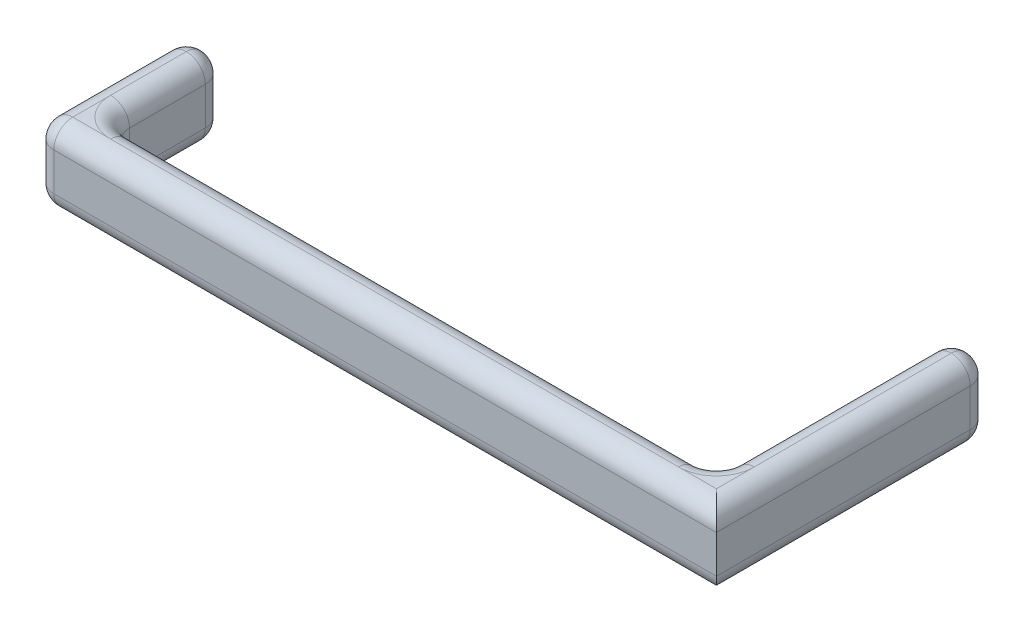
from build123d import *

# Parameters (mm, degrees)
SKETCH1_W           = 812.8
SKETCH1_H           = 101.6
BOSS_EXTRUDE1_DEPTH = 50.8
SKETCH2_W           = 50.8
SKETCH2_H           = 101.6
BOSS_EXTRUDE2_DEPTH = 203.2
SKETCH6_W           = 365.887
SKETCH6_H           = 101.6
BOSS_EXTRUDE4_DEPTH = 50.8
FILLET2_R           = 25.4


with BuildPart() as part:
    # Sketch1 → Boss-Extrude1 (new body)
    with BuildSketch(Plane.XY):
        with Locations((-406.4, 50.8)):
            Rectangle(SKETCH1_W, SKETCH1_H)
    extrude(amount=BOSS_EXTRUDE1_DEPTH)

    # Sketch2 → Boss-Extrude2 (add)
    with BuildSketch(Plane.XY.offset(50.8)):
        with Locations((-838.2, 50.8)):
            Rectangle(SKETCH2_W, SKETCH2_H)
        with Locations((25.4, 50.8)):
            Rectangle(SKETCH2_W, SKETCH2_H)
    extrude(amount=-BOSS_EXTRUDE2_DEPTH)

    # Sketch6 → Boss-Extrude4 (add)
    with BuildSketch(Plane(origin=(50.8, 0, 0), x_dir=(0, 0, -1), z_dir=(1, 0, 0))):
        with Locations((132.1435, 50.8)):
            Rectangle(SKETCH6_W, SKETCH6_H)
    extrude(amount=-BOSS_EXTRUDE4_DEPTH)

    # Fillet2
    fillet2_edges = [part.edges().sort_by_distance(p)[0] for p in [
        (-406.4, 0, 50.8),
        (-812.8, 101.6, -76.2),
        (-812.8, 50.8, -152.4),
        (-838.2, 0, -152.4),
        (-812.8, 0, -76.2),
        (-863.6, 50.8, -152.4),
        (-863.6, 0, -50.8),
        (-838.2, 101.6, -152.4),
        (-863.6, 101.6, -50.8),
        (-863.6, 50.8, 50.8),
        (0, 0, -157.5435),
        (0, 101.6, -157.5435),
        (50.8, 101.6, -132.1435),
        (50.8, 0, -132.1435),
        (50.8, 50.8, -315.087),
        (25.4, 0, -315.087),
        (0, 50.8, -315.087),
        (25.4, 101.6, -315.087),
        (-406.4, 0, 0),
        (-812.8, 50.8, 0),
        (-406.4, 101.6, 0),
        (0, 50.8, 0),
        (-406.4, 101.6, 50.8),
    ]]
    fillet(fillet2_edges, radius=FILLET2_R - 0.0001)  # a hair under: the kernel refuses the full size


solid = part.part
